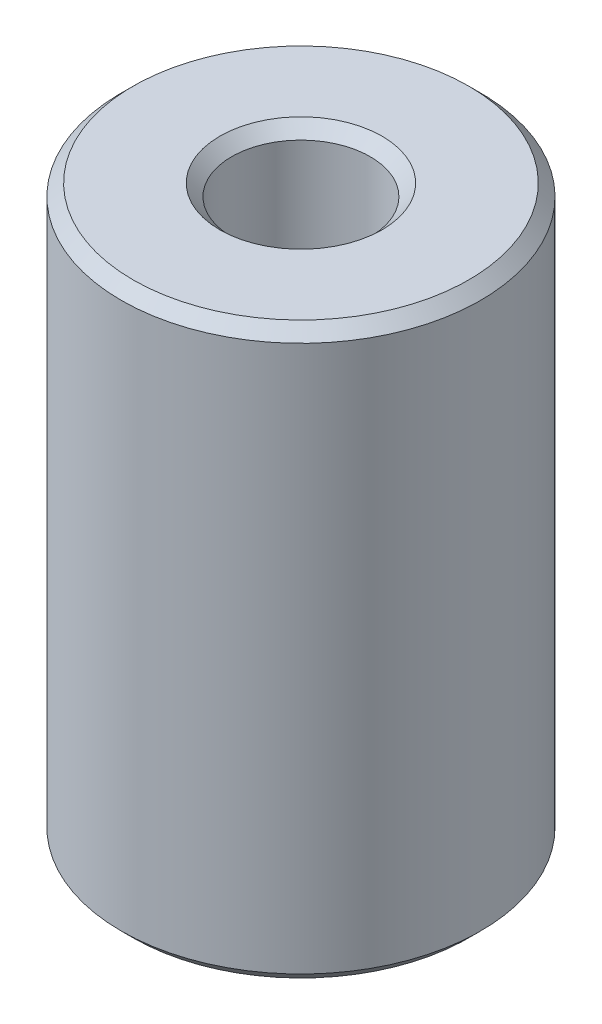
from build123d import *

# Parameters (mm, degrees)
SKETCH1_R           = 55
BOSS_EXTRUDE1_DEPTH = 174.444310482
SKETCH2_R           = 21.221035465
CUT_EXTRUDE1_DEPTH  = 191.999522145
CHAMFER1_SIZE       = 3.618286169


with BuildPart() as part:
    # Sketch1 → Boss-Extrude1 (new body)
    with BuildSketch(Plane(origin=(0, 0, 0), x_dir=(1, 0, 0), z_dir=(0, 1, 0))):
        Circle(SKETCH1_R)
    extrude(amount=BOSS_EXTRUDE1_DEPTH)

    # Sketch2 → Cut-Extrude1 (cut, through all)
    with BuildSketch(Plane(origin=(0, 0, 0), x_dir=(1, 0, 0), z_dir=(0, 1, 0))):
        Circle(SKETCH2_R)
    extrude(amount=CUT_EXTRUDE1_DEPTH, mode=Mode.SUBTRACT)

    # Chamfer1
    chamfer1_edges = [part.edges().sort_by_distance(p)[0] for p in [
        (-21.221035465, 174.444310482, 0),
        (-21.221035465, 0, 0),
        (-55, 0, 0),
        (-55, 174.444310482, 0),
    ]]
    chamfer(chamfer1_edges, length=CHAMFER1_SIZE)


solid = part.part
